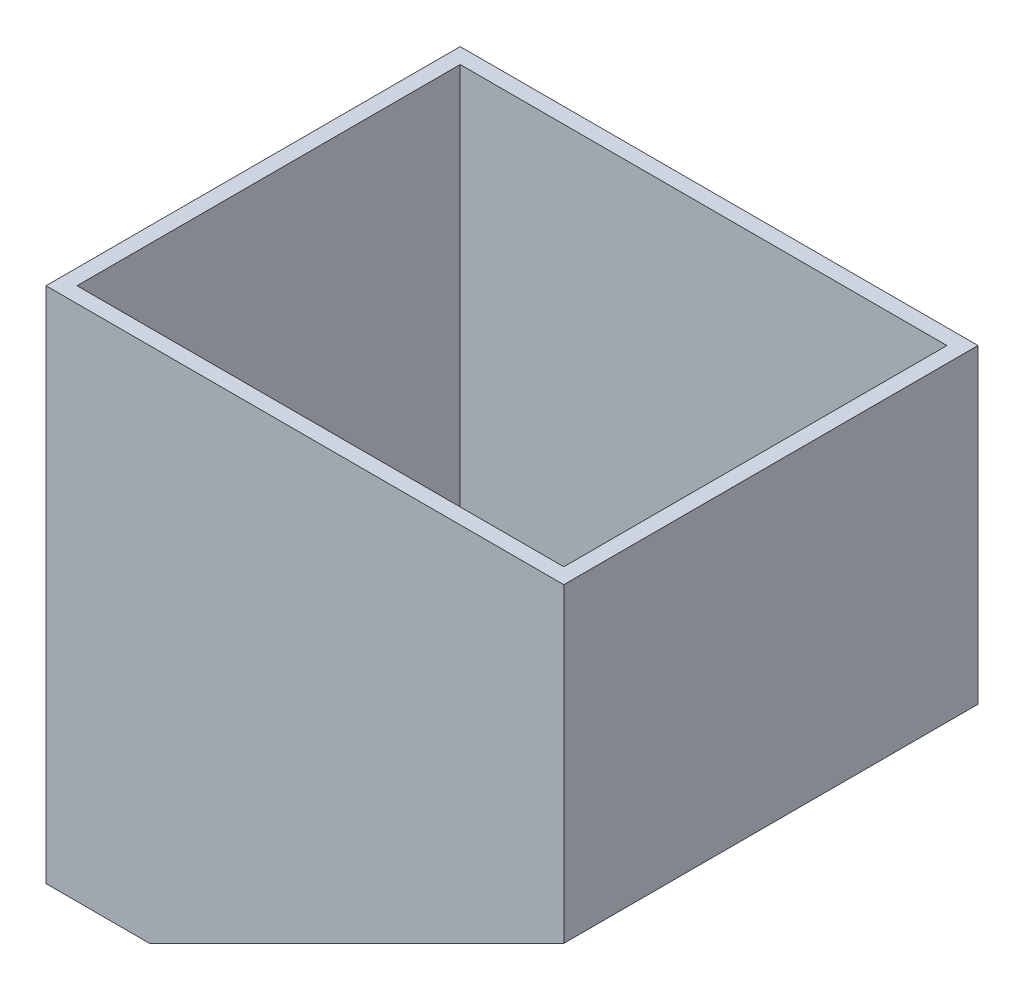
from build123d import *

# Parameters (mm, degrees)
SKETCH_2_W        = 80
SKETCH_2_H        = 100
EXTRUDE_1_DEPTH   = 100
OTHER_START       = 98.38699101
OTHER_1_OUTLINE_W = 92
OTHER_1_OUTLINE_H = 80
OTHER_1_DEPTH     = 35.77708764
SHELL_3_T         = -3


with BuildPart() as part:
    # 草图2 → 凸台-拉伸1 (new body)
    with BuildSketch(Plane(origin=(0, 0, 0), x_dir=(0, 0, -1), z_dir=(1, 0, 0))):
        with Locations((40, -50)):
            Rectangle(SKETCH_2_W, SKETCH_2_H)
    extrude(amount=EXTRUDE_1_DEPTH)

    # 边界-切除1: read off the stored shape, not the designer's step
    # 边界-切除1 outline → 边界-切除1 (cut)
    with BuildSketch(Plane(origin=(0, 0, 0), x_dir=(0.8944271909999159, 0.44721359549995804, 0), z_dir=(0.447213595499958, -0.894427190999916, 0)).offset(OTHER_START)):
        with Locations((18, -40)):
            Rectangle(OTHER_1_OUTLINE_W, OTHER_1_OUTLINE_H)
    extrude(amount=OTHER_1_DEPTH, mode=Mode.SUBTRACT)

    # 抽壳3
    shell_3_openings = [part.faces().sort_by_distance(p)[0] for p in [
        (10, -100, -40),
        (50, 0, -40),
    ]]
    offset(amount=SHELL_3_T, openings=shell_3_openings, kind=Kind.INTERSECTION)


solid = part.part
